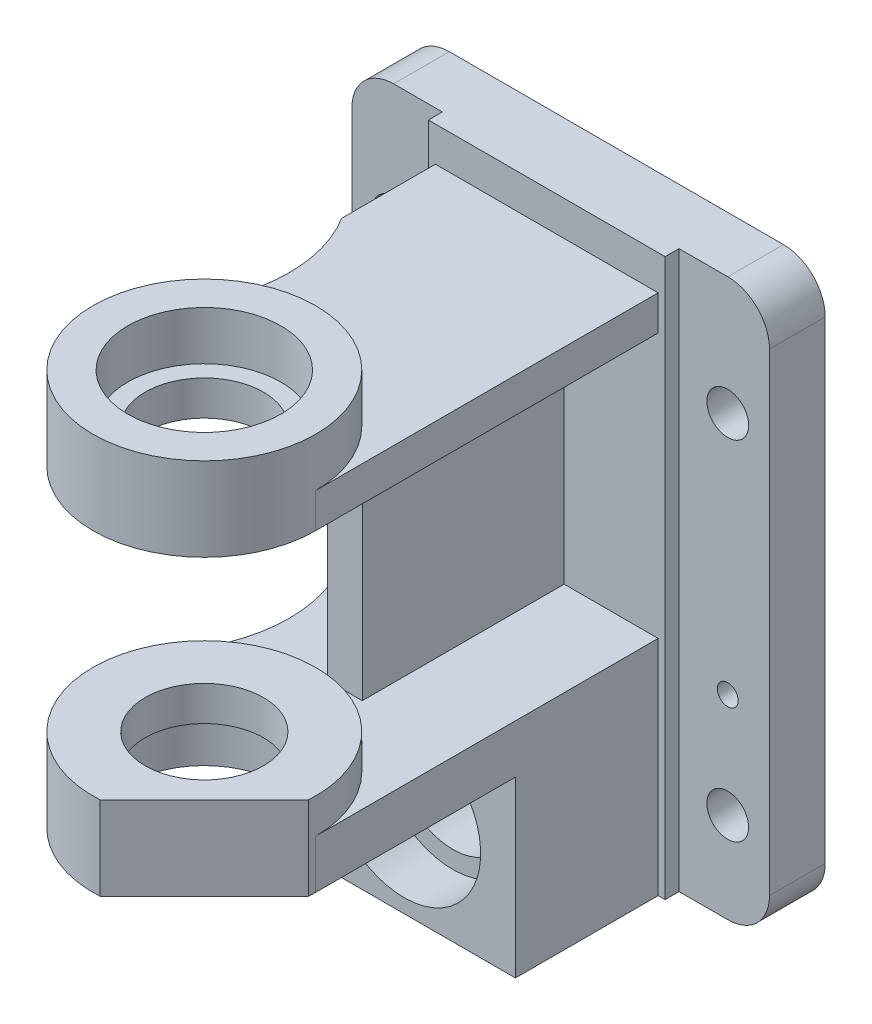
from build123d import *

# Parameters (mm, degrees)
EXTRUDE_1_DEPTH           = 8
SKETCH_3_W                = 34
SKETCH_3_H                = 80
EXTRUDE_2_DEPTH           = 2
CUT_EXTRUDE_1_DEPTH       = 8
CUT_EXTRUDE_2_DEPTH       = 7
SKETCH_6_W                = 32
SKETCH_6_H                = 25
EXTRUDE_4_DEPTH           = 20.5
SKETCH_7_R                = 11
CUT_EXTRUDE_5_DEPTH       = 7
SKETCH_8_R                = 8.5
CUT_EXTRUDE_6_DEPTH       = 8.5
SKETCH_9_R                = 11
CUT_EXTRUDE_7_DEPTH       = 7
EXTRUDE_5_DEPTH           = 7
EXTRUDE_6_DEPTH           = 5
SKETCH_13_R               = 8.5
CUT_EXTRUDE_8_DEPTH       = 5
SKETCH_14_R               = 11
CUT_EXTRUDE_9_DEPTH       = 7
SKETCH_15_R               = 8.5
EXTRUDE_7_DEPTH           = 5
SKETCH_16_R               = 16
SKETCH_16_R_2             = 11
EXTRUDE_8_DEPTH           = 7
F_6_0MM_START             = -8
F_6_0MM_1_OUTLINE_R       = 3
F_6_0MM_1_DEPTH           = 8
F_3_0MM_1_D               = 3
RIB_13_REACH              = 86.734
SKETCH_21_WALL_W          = 209.467873062
SKETCH_21_WALL_H          = 5
CUT_EXTRUDE_10_DEPTH      = 102.56692375
CUT_EXTRUDE_10_DEPTH_BACK = 102.56692375
SKETCH_23_R               = 20


# Read off the part's stored shape, not the designer's step: Ø6.0mm 暗销孔1
with BuildPart() as part:
    # 草图1 → 凸台-拉伸1 (new body)
    with BuildSketch(Plane.XY):
        with BuildLine():
            Line((24, -40), (-24, -40))
            ThreePointArc((-24, -40), (-28.242640687, -38.242640687), (-30, -34))
            Line((-30, -34), (-30, 34))
            ThreePointArc((-30, 34), (-28.242640687, 38.242640687), (-24, 40))
            Line((-24, 40), (24, 40))
            ThreePointArc((24, 40), (28.242640687, 38.242640687), (30, 34))
            Line((30, 34), (30, -34))
            ThreePointArc((30, -34), (28.242640687, -38.242640687), (24, -40))
        make_face()
    extrude(amount=-EXTRUDE_1_DEPTH)

    # 草图3 → 凸台-拉伸2 (add)
    with BuildSketch(Plane.XY):
        Rectangle(SKETCH_3_W, SKETCH_3_H)
    extrude(amount=EXTRUDE_2_DEPTH)

    # 草图4 → 切除-拉伸1 (cut)
    with BuildSketch(Plane(origin=(0, 0, -8), x_dir=(-1, 0, 0), z_dir=(0, 0, -1))):
        with BuildLine():
            Line((-14, -27), (-14, -40))
            Line((-14, -40), (14, -40))
            Line((14, -40), (14, -27))
            ThreePointArc((14, -27), (0, -13), (-14, -27))
        make_face()
    extrude(amount=-CUT_EXTRUDE_1_DEPTH, mode=Mode.SUBTRACT)

    # 草图5 → 切除-拉伸2 (cut)
    with BuildSketch(Plane(origin=(0, 0, -8), x_dir=(-1, 0, 0), z_dir=(0, 0, -1))):
        with BuildLine():
            Line((-2, -2), (-2, -13.143593539))
            ThreePointArc((-2, -13.143593539), (0, -13), (2, -13.143593539))
            Line((2, -13.143593539), (2, -2))
            ThreePointArc((2, -2), (0, 0), (-2, -2))
        make_face()
    extrude(amount=-CUT_EXTRUDE_2_DEPTH, mode=Mode.SUBTRACT)

    # 草图6 → 凸台-拉伸4 (add)
    with BuildSketch(Plane.XY.offset(2)):
        with Locations((0, -27.5)):
            Rectangle(SKETCH_6_W, SKETCH_6_H)
    extrude(amount=EXTRUDE_4_DEPTH)

    # 草图7 → 切除-拉伸5 (cut)
    with BuildSketch(Plane(origin=(0, 0, 0), x_dir=(-1, 0, 0), z_dir=(0, 0, -1))):
        with Locations((0, -27)):
            Circle(SKETCH_7_R)
    extrude(amount=-CUT_EXTRUDE_5_DEPTH, mode=Mode.SUBTRACT)

    # 草图8 → 切除-拉伸6 (cut)
    with BuildSketch(Plane(origin=(0, 0, 7), x_dir=(-1, 0, 0), z_dir=(0, 0, -1))):
        with Locations((0, -27)):
            Circle(SKETCH_8_R)
    extrude(amount=-CUT_EXTRUDE_6_DEPTH, mode=Mode.SUBTRACT)

    # 草图9 → 切除-拉伸7 (cut)
    with BuildSketch(Plane(origin=(0, 0, 15.5), x_dir=(-1, 0, 0), z_dir=(0, 0, -1))):
        with Locations((0, -27)):
            Circle(SKETCH_9_R)
    extrude(amount=-CUT_EXTRUDE_7_DEPTH, mode=Mode.SUBTRACT)

    # 草图11 → 凸台-拉伸5 (add)
    with BuildSketch(Plane(origin=(0, -15, 0), x_dir=(1, 0, 0), z_dir=(0, 1, 0))):
        with BuildLine():
            Line((-16, -2), (16, -2))
            Line((16, -2), (16, -51.2))
            ThreePointArc((16, -51.2), (15.99214711, -51.701229307), (15.968596148, -52.201966601))
            Line((15.968596148, -52.201966601), (1.001966601, -67.168596148))
            ThreePointArc((1.001966601, -67.168596148), (-10.953733026, -62.862578309), (-16, -51.2))
            Line((-16, -51.2), (-16, -2))
        make_face()
    extrude(amount=EXTRUDE_5_DEPTH)

    # 草图12 → 凸台-拉伸6 (add)
    with BuildSketch(Plane(origin=(0, -8, 0), x_dir=(1, 0, 0), z_dir=(0, 1, 0))):
        with BuildLine():
            Line((1.001966601, -67.168596148), (15.968596148, -52.201966601))
            ThreePointArc((15.968596148, -52.201966601), (-11.313708499, -39.886291501), (1.001966601, -67.168596148))
        make_face()
    extrude(amount=EXTRUDE_6_DEPTH)

    # 草图13 → 切除-拉伸8 (cut)
    with BuildSketch(Plane(origin=(0, -3, 0), x_dir=(1, 0, 0), z_dir=(0, 1, 0))):
        with Locations(Location((0, -51.2, 0), (0, 0, 270))):
            Circle(SKETCH_13_R)
    extrude(amount=-CUT_EXTRUDE_8_DEPTH, mode=Mode.SUBTRACT)

    # 草图14 → 切除-拉伸9 (cut)
    with BuildSketch(Plane(origin=(0, -8, 0), x_dir=(1, 0, 0), z_dir=(0, 1, 0))):
        with Locations(Location((0, -51.2, 0), (0, 0, 270))):
            Circle(SKETCH_14_R)
    extrude(amount=-CUT_EXTRUDE_9_DEPTH, mode=Mode.SUBTRACT)

    # 草图15 → 凸台-拉伸7 (add)
    with BuildSketch(Plane(origin=(0, 30, 0), x_dir=(1, 0, 0), z_dir=(0, 1, 0))):
        with BuildLine():
            Line((-16, -2), (16, -2))
            Line((16, -2), (16, -51.2))
            ThreePointArc((16, -51.2), (0, -67.2), (-16, -51.2))
            Line((-16, -51.2), (-16, -2))
        make_face()
        with Locations(Location((0, -51.2, 0), (0, 0, 270))):
            Circle(SKETCH_15_R, mode=Mode.SUBTRACT)
    extrude(amount=EXTRUDE_7_DEPTH)

    # 草图16 → 凸台-拉伸8 (add)
    with BuildSketch(Plane(origin=(0, 35, 0), x_dir=(1, 0, 0), z_dir=(0, 1, 0))):
        with Locations((0, -51.2)):
            Circle(SKETCH_16_R)
        with Locations(Location((0, -51.2, 0), (0, 0, 270))):
            Circle(SKETCH_16_R_2, mode=Mode.SUBTRACT)
    extrude(amount=EXTRUDE_8_DEPTH)

    # Ø6.0mm 暗销孔1 outline → Ø6.0mm 暗销孔1 (cut)
    with BuildSketch(Plane.XY.offset(F_6_0MM_START)):
        with Locations((-24, -27)):
            Circle(F_6_0MM_1_OUTLINE_R)
        with Locations((24, 23)):
            Circle(F_6_0MM_1_OUTLINE_R)
        with Locations((24, -27)):
            Circle(F_6_0MM_1_OUTLINE_R)
        with Locations((-24, 23)):
            Circle(F_6_0MM_1_OUTLINE_R)
    extrude(amount=F_6_0MM_1_DEPTH, mode=Mode.SUBTRACT)

    # Ø3.0mm 暗销孔1 (through all)
    with Locations(Plane.XY):
        with Locations((24, -12), (-24, 8)):
            Hole(F_3_0MM_1_D / 2)

    # 草图21 wall → 筋13 (add, up to next)
    with BuildSketch(Plane(origin=(0, 11, 31), x_dir=(0, -1, 0), z_dir=(0, 0, -1)), mode=Mode.PRIVATE) as rib_13_sk1:
        Rectangle(SKETCH_21_WALL_W, SKETCH_21_WALL_H)
    rib_13_tool1 = extrude(rib_13_sk1.sketch, amount=RIB_13_REACH, mode=Mode.PRIVATE) - part.part
    add(rib_13_tool1.solids().sort_by_distance((0, 11, 31))[0])

    # 草图23 → 切除-拉伸10 (cut, two sides: drawn at the far end of the back side and taken through both)
    with BuildSketch(Plane(origin=(0, 30, 0), x_dir=(1, 0, 0), z_dir=(0, 1, 0)).offset(-CUT_EXTRUDE_10_DEPTH_BACK)):
        with Locations((-33, -26)):
            Circle(SKETCH_23_R)
    extrude(amount=CUT_EXTRUDE_10_DEPTH + CUT_EXTRUDE_10_DEPTH_BACK, mode=Mode.SUBTRACT)


solid = part.part
